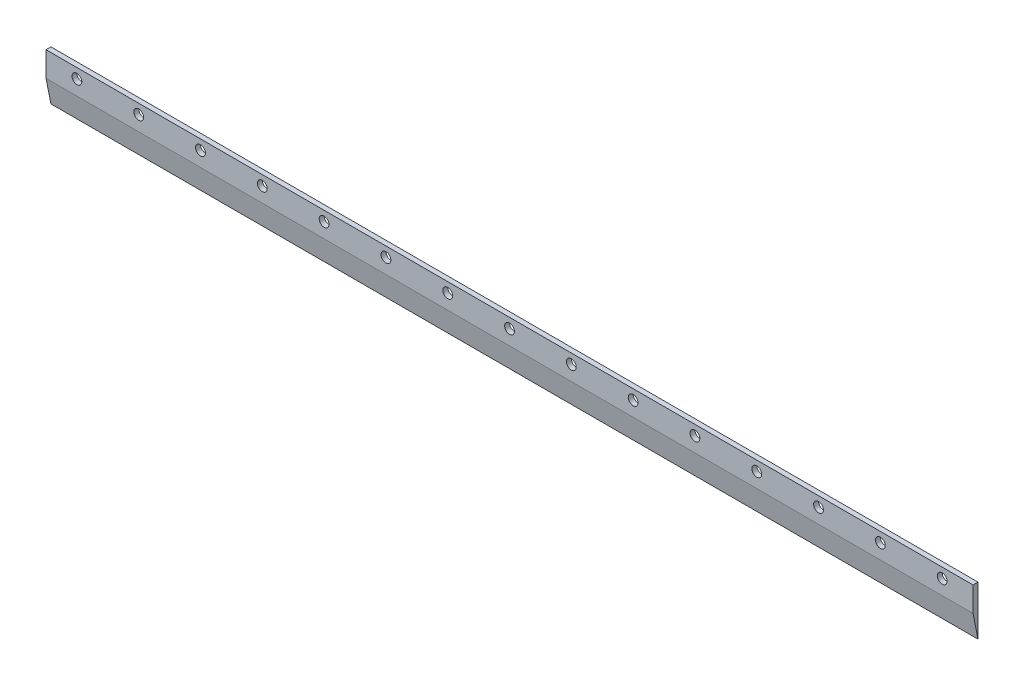
from build123d import *

# Parameters (mm, degrees)
CROQUIS1_W              = 750
CROQUIS1_H              = 40
SALIENTE_EXTRUIR1_DEPTH = 4
CORTAR_EXTRUIR1_DEPTH   = 751.277282076
CROQUIS3_R              = 3.96875
CORTAR_EXTRUIR2_DEPTH   = 10


with BuildPart() as part:
    # Croquis1 → Saliente-Extruir1 (new body)
    with BuildSketch(Plane.XY):
        Rectangle(CROQUIS1_W, CROQUIS1_H)
    extrude(amount=SALIENTE_EXTRUIR1_DEPTH)

    # Croquis2 → Cortar-Extruir1 (cut, through all)
    with BuildSketch(Plane(origin=(375, 0, 0), x_dir=(0, 0, -1), z_dir=(1, 0, 0))):
        Polygon((-4, -20), (0, -20), (-4, 0), align=None)
    extrude(amount=-CORTAR_EXTRUIR1_DEPTH, mode=Mode.SUBTRACT)

    # Croquis3 → Cortar-Extruir2 (cut)
    with BuildSketch(Plane(origin=(0, 0, 0), x_dir=(-1, 0, 0), z_dir=(0, 0, -1))):
        with Locations((-350, 12)):
            Circle(CROQUIS3_R)
        with Locations((-300, 12)):
            Circle(CROQUIS3_R)
        with Locations((-250, 12)):
            Circle(CROQUIS3_R)
        with Locations((-200, 12)):
            Circle(CROQUIS3_R)
        with Locations((-150, 12)):
            Circle(CROQUIS3_R)
        with Locations((-100, 12)):
            Circle(CROQUIS3_R)
        with Locations((-50, 12)):
            Circle(CROQUIS3_R)
        with Locations((0, 12)):
            Circle(CROQUIS3_R)
        with Locations((50, 12)):
            Circle(CROQUIS3_R)
        with Locations((100, 12)):
            Circle(CROQUIS3_R)
        with Locations((150, 12)):
            Circle(CROQUIS3_R)
        with Locations((200, 12)):
            Circle(CROQUIS3_R)
        with Locations((250, 12)):
            Circle(CROQUIS3_R)
        with Locations((300, 12)):
            Circle(CROQUIS3_R)
        with Locations((350, 12)):
            Circle(CROQUIS3_R)
    extrude(amount=-CORTAR_EXTRUIR2_DEPTH, mode=Mode.SUBTRACT)


solid = part.part
